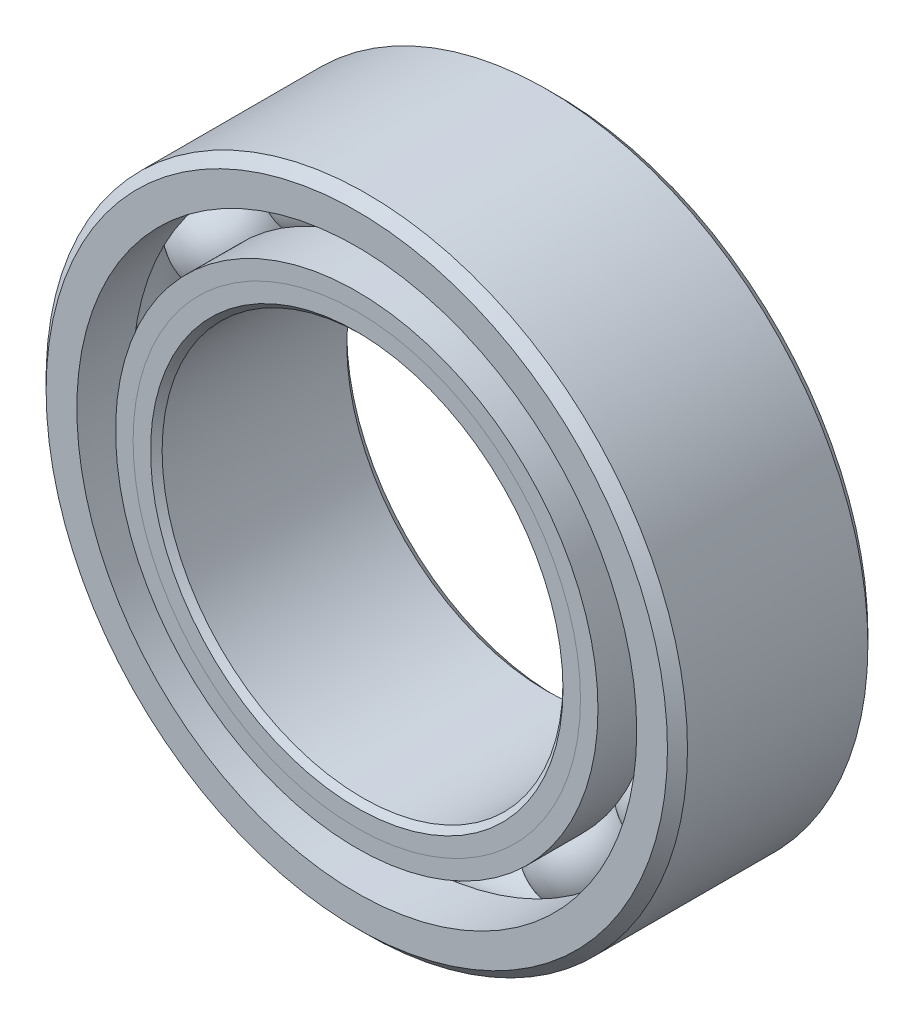
from build123d import *

# Parameters (mm, degrees)
CIRPATTERN1_COUNT = 12


with BuildPart() as part:
    # Sketch1 → Revolve1 (revolve)
    with BuildSketch(Plane(origin=(0, 0, 0), x_dir=(0, 0, -1), z_dir=(1, 0, 0))):
        with BuildLine():
            Line((1.7859375, 6.35), (-1.7859375, 6.35))
            Line((-1.7859375, 6.35), (-1.984375, 6.1515625))
            Line((-1.984375, 6.1515625), (-1.984375, 5.543166209))
            Line((-1.984375, 5.543166209), (-0.881944444, 5.543166209))
            ThreePointArc((-0.881944444, 5.543166209), (0, 6.121207467), (0.881944444, 5.543166209))
            Line((0.881944444, 5.543166209), (1.984375, 5.543166209))
            Line((1.984375, 5.543166209), (1.984375, 6.1515625))
            Line((1.984375, 6.1515625), (1.7859375, 6.35))
        make_face()
    revolve(axis=Axis((0, 0, 1.984375), (0, 0, -1)))


with BuildPart() as body_2:
    # Sketch2 → Revolve2 (revolve)
    with BuildSketch(Plane(origin=(0, 0, 0), x_dir=(0, 0, -1), z_dir=(1, 0, 0))):
        with BuildLine():
            Line((-1.984375, 4.775583791), (-0.881944444, 4.775583791))
            ThreePointArc((-0.881944444, 4.775583791), (-0.527247025, 4.354929682), (0, 4.197542533))
            Line((0, 4.197542533), (0, 4.083146266))
            Line((0, 4.083146266), (-1.638156238, 4.083146266))
            Line((-1.638156238, 4.083146266), (-1.984375, 4.429365029))
            Line((-1.984375, 4.429365029), (-1.984375, 4.775583791))
        make_face()
    revolve(axis=Axis((0, 0, 1.984375), (0, 0, -1)))


with BuildPart() as body_3:
    # Sketch3 → Revolve3 (revolve)
    with BuildSketch(Plane(origin=(0, 0, 0), x_dir=(0, 0, -1), z_dir=(1, 0, 0))):
        with BuildLine():
            Line((-1.984375, 4.429365029), (-1.638156238, 4.083146266))
            Line((-1.638156238, 4.083146266), (0, 4.083146266))
            Line((0, 4.083146266), (0, 4.197542533))
            ThreePointArc((0, 4.197542533), (0.527247025, 4.354929682), (0.881944444, 4.775583791))
            Line((0.881944444, 4.775583791), (1.984375, 4.775583791))
            Line((1.984375, 4.775583791), (1.984375, 4.1671875))
            Line((1.984375, 4.1671875), (1.7859375, 3.96875))
            Line((1.7859375, 3.96875), (-1.869978734, 3.96875))
            Line((-1.869978734, 3.96875), (-1.984375, 4.083146266))
            Line((-1.984375, 4.083146266), (-1.984375, 4.429365029))
        make_face()
    revolve(axis=Axis((0, 0, 1.984375), (0, 0, -1)))


with BuildPart() as body_4:
    # Sketch4 → Revolve4 (revolve)
    with BuildSketch(Plane(origin=(0, 0, 0), x_dir=(0, 0, -1), z_dir=(1, 0, 0))):
        with BuildLine():
            Line((-0.961832467, 5.159375), (0.961832467, 5.159375))
            ThreePointArc((0.961832467, 5.159375), (0, 6.121207467), (-0.961832467, 5.159375))
        make_face()
    revolve(axis=Axis((0, 5.159375, 0.961832467), (0, 0, -1)))


with BuildPart() as cirpattern1_1:
    # CirPattern1: pattern copy
    add(body_4.part.rotate(Axis((0, 0, -1.984375), (0, 0, 1)), 1 * 360 / CIRPATTERN1_COUNT))


with BuildPart() as cirpattern1_2:
    # CirPattern1: pattern copy
    add(body_4.part.rotate(Axis((0, 0, -1.984375), (0, 0, 1)), 2 * 360 / CIRPATTERN1_COUNT))


with BuildPart() as cirpattern1_3:
    # CirPattern1: pattern copy
    add(body_4.part.rotate(Axis((0, 0, -1.984375), (0, 0, 1)), 3 * 360 / CIRPATTERN1_COUNT))


with BuildPart() as cirpattern1_4:
    # CirPattern1: pattern copy
    add(body_4.part.rotate(Axis((0, 0, -1.984375), (0, 0, 1)), 4 * 360 / CIRPATTERN1_COUNT))


with BuildPart() as cirpattern1_5:
    # CirPattern1: pattern copy
    add(body_4.part.rotate(Axis((0, 0, -1.984375), (0, 0, 1)), 5 * 360 / CIRPATTERN1_COUNT))


with BuildPart() as cirpattern1_6:
    # CirPattern1: pattern copy
    add(body_4.part.rotate(Axis((0, 0, -1.984375), (0, 0, 1)), 6 * 360 / CIRPATTERN1_COUNT))


with BuildPart() as cirpattern1_7:
    # CirPattern1: pattern copy
    add(body_4.part.rotate(Axis((0, 0, -1.984375), (0, 0, 1)), 7 * 360 / CIRPATTERN1_COUNT))


with BuildPart() as cirpattern1_8:
    # CirPattern1: pattern copy
    add(body_4.part.rotate(Axis((0, 0, -1.984375), (0, 0, 1)), 8 * 360 / CIRPATTERN1_COUNT))


with BuildPart() as cirpattern1_9:
    # CirPattern1: pattern copy
    add(body_4.part.rotate(Axis((0, 0, -1.984375), (0, 0, 1)), 9 * 360 / CIRPATTERN1_COUNT))


with BuildPart() as cirpattern1_10:
    # CirPattern1: pattern copy
    add(body_4.part.rotate(Axis((0, 0, -1.984375), (0, 0, 1)), 10 * 360 / CIRPATTERN1_COUNT))


with BuildPart() as cirpattern1_11:
    # CirPattern1: pattern copy
    add(body_4.part.rotate(Axis((0, 0, -1.984375), (0, 0, 1)), 11 * 360 / CIRPATTERN1_COUNT))


solid = Compound([part.part, body_2.part, body_3.part, body_4.part, cirpattern1_1.part, cirpattern1_2.part, cirpattern1_3.part, cirpattern1_4.part, cirpattern1_5.part, cirpattern1_6.part, cirpattern1_7.part, cirpattern1_8.part, cirpattern1_9.part, cirpattern1_10.part, cirpattern1_11.part])
